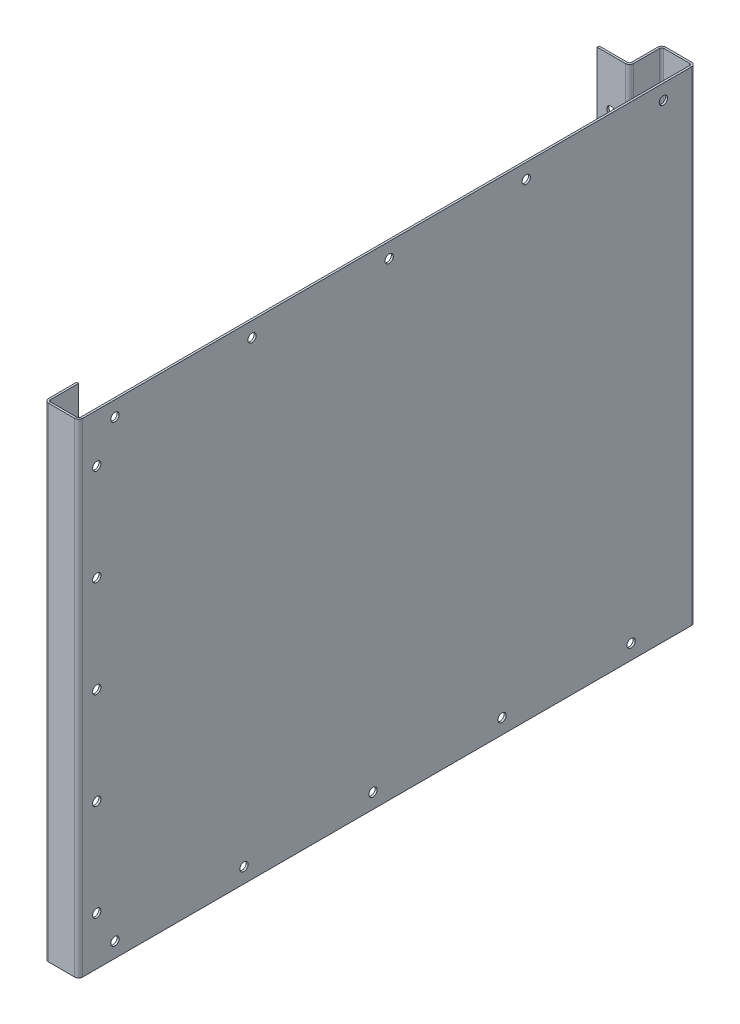
from build123d import *

# Parameters (mm, degrees)
SKETCH1_W                    = 482.6
SKETCH1_H                    = 381
BOSS_EXTRUDE1_DEPTH          = 1.6002
EDGE_FLANGE1_STRIP_W         = 9.6012
EDGE_FLANGE1_STRIP_H         = 1.6002
EDGE_FLANGE1_STRIP_CUT_DEPTH = 381
EDGE_FLANGE1_DEPTH           = 381
EDGE_FLANGE2_STRIP_W         = 9.6012
EDGE_FLANGE2_STRIP_H         = 1.6002
EDGE_FLANGE2_STRIP_CUT_DEPTH = 381
EDGE_FLANGE2_DEPTH           = 381
EDGE_FLANGE3_STRIP_W         = 9.6012
EDGE_FLANGE3_STRIP_H         = 1.6002
EDGE_FLANGE3_STRIP_CUT_DEPTH = 381
EDGE_FLANGE3_DEPTH           = 381
EDGE_FLANGE4_STRIP_W         = 9.6012
EDGE_FLANGE4_STRIP_H         = 1.6002
EDGE_FLANGE4_STRIP_CUT_DEPTH = 381
EDGE_FLANGE4_DEPTH           = 381
EDGE_FLANGE5_STRIP_W         = 9.6012
EDGE_FLANGE5_STRIP_H         = 1.6002
EDGE_FLANGE5_STRIP_CUT_DEPTH = 381
EDGE_FLANGE5_DEPTH           = 381
SKETCH24_R                   = 3.2639
CUT_EXTRUDE2_DEPTH           = 2.54
SKETCH25_R                   = 3.2639
CUT_EXTRUDE3_DEPTH           = 310.870566463
SKETCH26_R                   = 3.2639
CUT_EXTRUDE4_DEPTH           = 2.54
SKETCH27_R                   = 3.2639
CUT_EXTRUDE6_DEPTH           = 2.54
SKETCH29_R                   = 3.2639
CUT_EXTRUDE7_DEPTH           = 2.54


# Sheet-metal steps are written as plain solids
with BuildPart() as part:
    # Sketch1 → Boss-Extrude1 (new body)
    with BuildSketch(Plane(origin=(0, 0, 0), x_dir=(0, 0, -1), z_dir=(1, 0, 0))):
        Rectangle(SKETCH1_W, SKETCH1_H)
    extrude(amount=BOSS_EXTRUDE1_DEPTH)

    # Edge-Flange1 strip (across the edge) → Edge-Flange1 strip cut (cut)
    with BuildSketch(Plane(origin=(0, 190.5, -241.3), x_dir=(0, 0, 1), z_dir=(0, -1, 0))):
        with Locations((-3.2004, -0.8001)):
            Rectangle(EDGE_FLANGE1_STRIP_W, EDGE_FLANGE1_STRIP_H)
    extrude(amount=EDGE_FLANGE1_STRIP_CUT_DEPTH, mode=Mode.SUBTRACT)

    # Edge-Flange1 section (across the edge) → Edge-Flange1 (add)
    with BuildSketch(Plane(origin=(0, 190.5, -241.3), x_dir=(0, 0, 1), z_dir=(0, -1, 0))):
        with BuildLine():
            Line((-1.6002, 1.6002), (-1.6002, 23.51278))
            Line((-1.6002, 23.51278), (0, 23.51278))
            Line((0, 23.51278), (0, 1.6002))
            ThreePointArc((0, 1.6002), (0.468687729, 0.468687729), (1.6002, 0))
            Line((1.6002, 0), (1.6002, -1.6002))
            ThreePointArc((1.6002, -1.6002), (-0.662824543, -0.662824543), (-1.6002, 1.6002))
        make_face()
    extrude(amount=EDGE_FLANGE1_DEPTH)

    # Edge-Flange2 strip (across the edge) → Edge-Flange2 strip cut (cut)
    with BuildSketch(Plane(origin=(-23.51278, 190.5, -241.3), x_dir=(1, 0, 0), z_dir=(0, -1, 0))):
        with Locations((-3.2004, -0.8001)):
            Rectangle(EDGE_FLANGE2_STRIP_W, EDGE_FLANGE2_STRIP_H)
    extrude(amount=EDGE_FLANGE2_STRIP_CUT_DEPTH, mode=Mode.SUBTRACT)

    # Edge-Flange2 section (across the edge) → Edge-Flange2 (add)
    with BuildSketch(Plane(origin=(-23.51278, 190.5, -241.3), x_dir=(1, 0, 0), z_dir=(0, -1, 0))):
        with BuildLine():
            Line((-1.6002, 1.6002), (-1.6002, 23.7998))
            Line((-1.6002, 23.7998), (0, 23.7998))
            Line((0, 23.7998), (0, 1.6002))
            ThreePointArc((0, 1.6002), (0.468687729, 0.468687729), (1.6002, 0))
            Line((1.6002, 0), (1.6002, -1.6002))
            ThreePointArc((1.6002, -1.6002), (-0.662824543, -0.662824543), (-1.6002, 1.6002))
        make_face()
    extrude(amount=EDGE_FLANGE2_DEPTH)

    # Edge-Flange3 strip (across the edge) → Edge-Flange3 strip cut (cut)
    with BuildSketch(Plane(origin=(-25.11298, -190.5, -217.5002), x_dir=(0, 0, -1), z_dir=(0, 1, 0))):
        with Locations((-3.2004, -0.8001)):
            Rectangle(EDGE_FLANGE3_STRIP_W, EDGE_FLANGE3_STRIP_H)
    extrude(amount=EDGE_FLANGE3_STRIP_CUT_DEPTH, mode=Mode.SUBTRACT)

    # Edge-Flange3 section (across the edge) → Edge-Flange3 (add)
    with BuildSketch(Plane(origin=(-25.11298, -190.5, -217.5002), x_dir=(0, 0, -1), z_dir=(0, 1, 0))):
        with BuildLine():
            Line((-1.6002, 1.6002), (-1.6002, 23.7998))
            Line((-1.6002, 23.7998), (0, 23.7998))
            Line((0, 23.7998), (0, 1.6002))
            ThreePointArc((0, 1.6002), (0.468687729, 0.468687729), (1.6002, 0))
            Line((1.6002, 0), (1.6002, -1.6002))
            ThreePointArc((1.6002, -1.6002), (-0.662824543, -0.662824543), (-1.6002, 1.6002))
        make_face()
    extrude(amount=EDGE_FLANGE3_DEPTH)

    # Edge-Flange4 strip (across the edge) → Edge-Flange4 strip cut (cut)
    with BuildSketch(Plane(origin=(0, -190.5, 241.3), x_dir=(0, 0, -1), z_dir=(0, 1, 0))):
        with Locations((-3.2004, -0.8001)):
            Rectangle(EDGE_FLANGE4_STRIP_W, EDGE_FLANGE4_STRIP_H)
    extrude(amount=EDGE_FLANGE4_STRIP_CUT_DEPTH, mode=Mode.SUBTRACT)

    # Edge-Flange4 section (across the edge) → Edge-Flange4 (add)
    with BuildSketch(Plane(origin=(0, -190.5, 241.3), x_dir=(0, 0, -1), z_dir=(0, 1, 0))):
        with BuildLine():
            Line((-1.6002, 1.6002), (-1.6002, 23.7998))
            Line((-1.6002, 23.7998), (0, 23.7998))
            Line((0, 23.7998), (0, 1.6002))
            ThreePointArc((0, 1.6002), (0.468687729, 0.468687729), (1.6002, 0))
            Line((1.6002, 0), (1.6002, -1.6002))
            ThreePointArc((1.6002, -1.6002), (-0.662824543, -0.662824543), (-1.6002, 1.6002))
        make_face()
    extrude(amount=EDGE_FLANGE4_DEPTH)

    # Edge-Flange5 strip (across the edge) → Edge-Flange5 strip cut (cut)
    with BuildSketch(Plane(origin=(-23.7998, -190.5, 241.3), x_dir=(1, 0, 0), z_dir=(0, 1, 0))):
        with Locations((-3.2004, -0.8001)):
            Rectangle(EDGE_FLANGE5_STRIP_W, EDGE_FLANGE5_STRIP_H)
    extrude(amount=EDGE_FLANGE5_STRIP_CUT_DEPTH, mode=Mode.SUBTRACT)

    # Edge-Flange5 section (across the edge) → Edge-Flange5 (add)
    with BuildSketch(Plane(origin=(-23.7998, -190.5, 241.3), x_dir=(1, 0, 0), z_dir=(0, 1, 0))):
        with BuildLine():
            Line((-1.6002, 1.6002), (-1.6002, 23.7998))
            Line((-1.6002, 23.7998), (0, 23.7998))
            Line((0, 23.7998), (0, 1.6002))
            ThreePointArc((0, 1.6002), (0.468687729, 0.468687729), (1.6002, 0))
            Line((1.6002, 0), (1.6002, -1.6002))
            ThreePointArc((1.6002, -1.6002), (-0.662824543, -0.662824543), (-1.6002, 1.6002))
        make_face()
    extrude(amount=EDGE_FLANGE5_DEPTH)

    # Sketch24 → Cut-Extrude2 (cut)
    with BuildSketch(Plane.XY.offset(-215.9)):
        with Locations((-38.04158, 152.4)):
            Circle(SKETCH24_R)
        with Locations((-38.04158, 76.2)):
            Circle(SKETCH24_R)
        with Locations((-38.04158, 0)):
            Circle(SKETCH24_R)
        with Locations((-38.04158, -76.2)):
            Circle(SKETCH24_R)
        with Locations((-38.04158, -152.4)):
            Circle(SKETCH24_R)
    extrude(amount=-CUT_EXTRUDE2_DEPTH, mode=Mode.SUBTRACT)

    # Sketch25 → Cut-Extrude3 (cut, through all)
    with BuildSketch(Plane.ZY.offset(25.4)):
        with Locations((228.6, 152.4)):
            Circle(SKETCH25_R)
        with Locations((228.6, 76.2)):
            Circle(SKETCH25_R)
        with Locations((228.6, -76.2)):
            Circle(SKETCH25_R)
        with Locations((228.6, -152.4)):
            Circle(SKETCH25_R)
        with Locations((228.6, 0)):
            Circle(SKETCH25_R)
    extrude(amount=-CUT_EXTRUDE3_DEPTH, mode=Mode.SUBTRACT)

    # Sketch26 → Cut-Extrude4 (cut)
    with BuildSketch(Plane(origin=(0, 0, -242.9002), x_dir=(-1, 0, 0), z_dir=(0, 0, -1))):
        with Locations((10.4902, 152.4)):
            Circle(SKETCH26_R)
        with Locations((10.4902, 76.2)):
            Circle(SKETCH26_R)
        with Locations((10.4902, 0)):
            Circle(SKETCH26_R)
        with Locations((10.4902, -76.2)):
            Circle(SKETCH26_R)
        with Locations((10.4902, -152.4)):
            Circle(SKETCH26_R)
    extrude(amount=-CUT_EXTRUDE4_DEPTH, mode=Mode.SUBTRACT)

    # Sketch27 → Cut-Extrude6 (cut)
    with BuildSketch(Plane(origin=(1.6002, 0, 0), x_dir=(0, 0, -1), z_dir=(1, 0, 0))):
        with Locations((-214.2998, 178.689)):
            Circle(SKETCH27_R)
        with Locations((-106.3498, 178.689)):
            Circle(SKETCH27_R)
        with Locations((1.6002, 178.689)):
            Circle(SKETCH27_R)
        with Locations((109.5502, 178.689)):
            Circle(SKETCH27_R)
        with Locations((217.5002, 178.689)):
            Circle(SKETCH27_R)
    extrude(amount=-CUT_EXTRUDE6_DEPTH, mode=Mode.SUBTRACT)

    # Sketch29 → Cut-Extrude7 (cut)
    with BuildSketch(Plane.ZY):
        with Locations((-192.1002, -178.7144)):
            Circle(SKETCH29_R)
        with Locations((-90.5002, -178.7144)):
            Circle(SKETCH29_R)
        with Locations((11.0998, -178.7144)):
            Circle(SKETCH29_R)
        with Locations((112.6998, -178.7144)):
            Circle(SKETCH29_R)
        with Locations((214.2998, -178.7144)):
            Circle(SKETCH29_R)
    extrude(amount=-CUT_EXTRUDE7_DEPTH, mode=Mode.SUBTRACT)


solid = part.part
